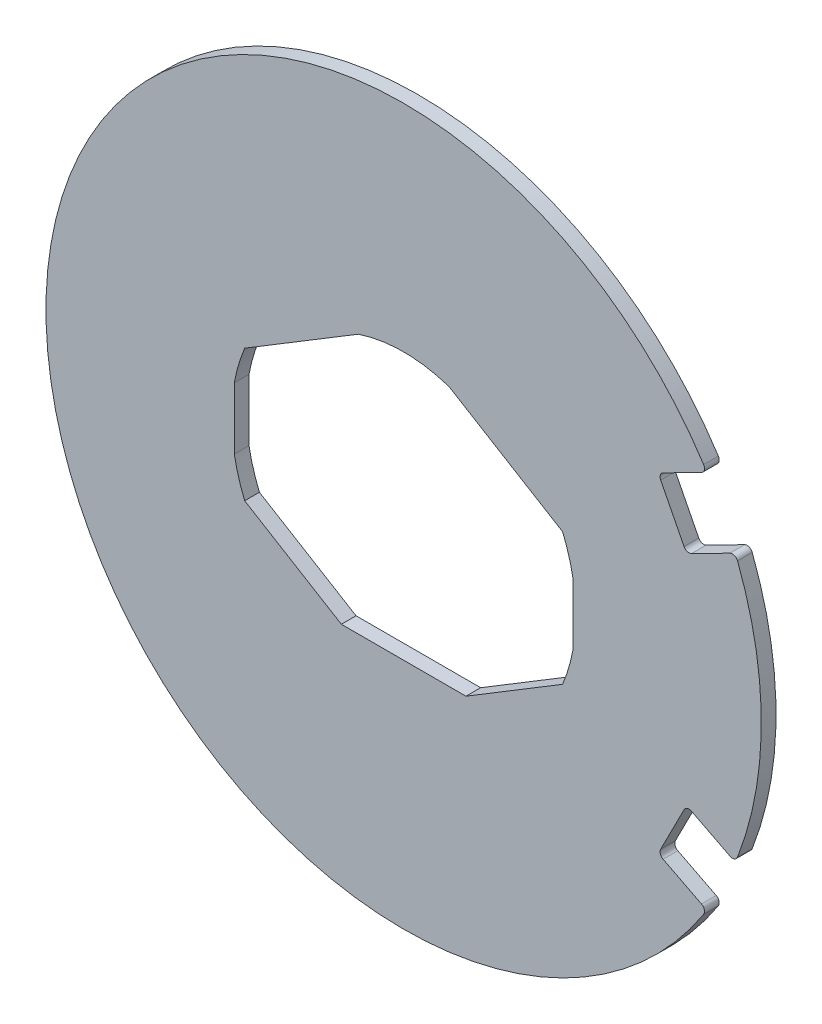
from build123d import *

# Parameters (mm, degrees)
BOSS_EXTRU_1_DEPTH = 0.8
EMPREINTE1_DEPTH   = 0.8


# Read off the part's stored shape, not the designer's step: Empreinte1
with BuildPart() as part:
    # Esquisse1 → Boss.-Extru.1 (new body)
    with BuildSketch(Plane.XY):
        with BuildLine():
            Line((13.976920297, 8.69285333), (15.248093696, 6.198035062))
            ThreePointArc((15.248093696, 6.198035062), (15.422690555, 6.048915257), (15.651592804, 6.066930255))
            Line((15.651592804, 6.066930255), (17.741248134, 7.131662826))
            ThreePointArc((17.741248134, 7.131662826), (17.984943021, 7.144439851), (18.1575097, 6.971896548))
            ThreePointArc((18.1575097, 6.971896548), (19.45, 0), (18.1575097, -6.971896548))
            ThreePointArc((18.1575097, -6.971896548), (17.984943021, -7.144439851), (17.741248134, -7.131662826))
            Line((17.741248134, -7.131662826), (15.651592804, -6.066930255))
            ThreePointArc((15.651592804, -6.066930255), (15.422690555, -6.048915257), (15.248093696, -6.198035062))
            Line((15.248093696, -6.198035062), (13.976920297, -8.69285333))
            ThreePointArc((13.976920297, -8.69285333), (13.958905299, -8.921755578), (14.108025104, -9.096352437))
            Line((14.108025104, -9.096352437), (16.197680434, -10.161085008))
            ThreePointArc((16.197680434, -10.161085008), (16.351257526, -10.350728166), (16.313099211, -10.591755952))
            ThreePointArc((16.313099211, -10.591755952), (-19.45, 0), (16.313099211, 10.591755952))
            ThreePointArc((16.313099211, 10.591755952), (16.351257526, 10.350728166), (16.197680434, 10.161085008))
            Line((16.197680434, 10.161085008), (14.108025104, 9.096352437))
            ThreePointArc((14.108025104, 9.096352437), (13.958905299, 8.921755578), (13.976920297, 8.69285333))
        make_face()
    extrude(amount=BOSS_EXTRU_1_DEPTH)

    # Empreinte1 outline → Empreinte1 (cut)
    with BuildSketch(Plane.XY):
        with BuildLine():
            ThreePointArc((9.2092, 1.678974794), (8.977813151, 2.650885141), (8.644162553, 3.5926))
            Line((8.644162553, 3.5926), (2.470606857, 7.337))
            ThreePointArc((2.470606857, 7.337), (0, 7.7418), (-2.470606857, 7.337))
            Line((-2.470606857, 7.337), (-8.644162553, 3.5926))
            ThreePointArc((-8.644162553, 3.5926), (-8.977813151, 2.650885141), (-9.2092, 1.678974794))
            Line((-9.2092, 1.678974794), (-9.2092, -1.678974794))
            ThreePointArc((-9.2092, -1.678974794), (-8.977813151, -2.650885141), (-8.644162553, -3.5926))
            Line((-8.644162553, -3.5926), (-3.388297568, -6.7804))
            Line((-3.388297568, -6.7804), (3.388297568, -6.7804))
            Line((3.388297568, -6.7804), (8.644162553, -3.5926))
            ThreePointArc((8.644162553, -3.5926), (8.977813151, -2.650885141), (9.2092, -1.678974794))
            Line((9.2092, -1.678974794), (9.2092, 1.678974794))
        make_face()
    extrude(amount=EMPREINTE1_DEPTH, mode=Mode.SUBTRACT)


solid = part.part
